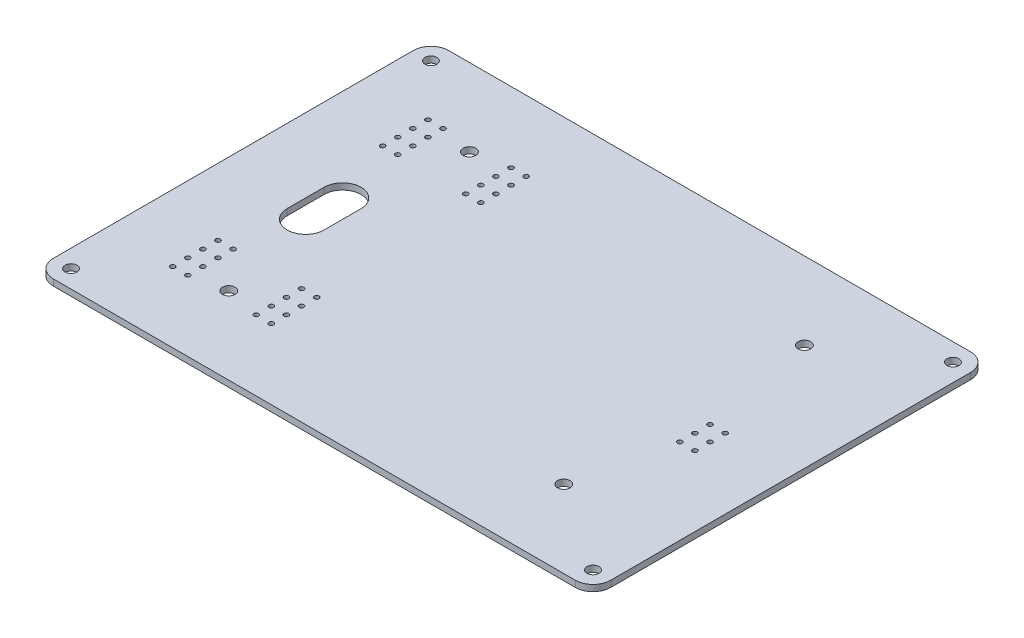
from build123d import *

# Parameters (mm, degrees)
BOSS_EXTRUDE1_DEPTH = 1.5875
SKETCH2_R           = 1.5875
CUT_EXTRUDE1_DEPTH  = 87.546171446
CUT_EXTRUDE2_DEPTH  = 87.546171446
SKETCH7_R           = 0.6
CUT_EXTRUDE3_DEPTH  = 87.546171446
SKETCH9_R           = 1.5
CUT_EXTRUDE4_DEPTH  = 87.546171446


with BuildPart() as part:
    # Sketch1 → Boss-Extrude1 (new body)
    with BuildSketch(Plane(origin=(0, 0, 0), x_dir=(1, 0, 0), z_dir=(0, 1, 0))):
        with BuildLine():
            Line((-65.410639449, -49.868760551), (66.237560551, -49.868760551))
            ThreePointArc((66.237560551, -49.868760551), (69.404663929, -48.556903378), (70.716521102, -45.3898))
            Line((70.716521102, -45.3898), (70.716521102, 45.3898))
            ThreePointArc((70.716521102, 45.3898), (69.404663929, 48.556903378), (66.237560551, 49.868760551))
            Line((66.237560551, 49.868760551), (-65.410639449, 49.868760551))
            ThreePointArc((-65.410639449, 49.868760551), (-68.577742827, 48.556903378), (-69.8896, 45.3898))
            Line((-69.8896, 45.3898), (-69.8896, -45.3898))
            ThreePointArc((-69.8896, -45.3898), (-68.577742827, -48.556903378), (-65.410639449, -49.868760551))
        make_face()
    extrude(amount=-BOSS_EXTRUDE1_DEPTH)

    # Sketch2 → Cut-Extrude1 (cut, through all)
    with BuildSketch(Plane(origin=(0, 0, 0), x_dir=(1, 0, 0), z_dir=(0, 1, 0))):
        with Locations((-40.6725, -30.35)):
            Circle(SKETCH2_R)
        with Locations((-40.6725, 30.35)):
            Circle(SKETCH2_R)
        with Locations((43.8275, 30.35)):
            Circle(SKETCH2_R)
        with Locations((43.8275, -30.35)):
            Circle(SKETCH2_R)
    extrude(amount=-CUT_EXTRUDE1_DEPTH, mode=Mode.SUBTRACT)

    # Sketch3 → Cut-Extrude2 (cut, through all)
    with BuildSketch(Plane(origin=(0, 0, 0), x_dir=(1, 0, 0), z_dir=(0, 1, 0))):
        with BuildLine():
            Line((-41.933471413, 4.284952831), (-41.933471413, -5.034952831))
            ThreePointArc((-41.933471413, -5.034952831), (-46.603471413, -9.704952831), (-51.273471413, -5.034952831))
            Line((-51.273471413, -5.034952831), (-51.273471413, 4.284952831))
            ThreePointArc((-51.273471413, 4.284952831), (-46.603471413, 8.954952831), (-41.933471413, 4.284952831))
        make_face()
    extrude(amount=-CUT_EXTRUDE2_DEPTH, mode=Mode.SUBTRACT)

    # Sketch7 → Cut-Extrude3 (cut, through all)
    with BuildSketch(Plane.XZ.offset(1.5875)):
        with Locations((49.2175, 6.483)):
            Circle(SKETCH7_R)
        with Locations((-49.1085, -32.125)):
            Circle(SKETCH7_R)
        with Locations((-28.1535, -32.125)):
            Circle(SKETCH7_R)
        with Locations((-28.1535, 20.707)):
            Circle(SKETCH7_R)
        with Locations((-49.2355, 20.707)):
            Circle(SKETCH7_R)
        with Locations((-31.9635, 20.707)):
            Circle(SKETCH7_R)
        with Locations((-53.0455, 20.707)):
            Circle(SKETCH7_R)
        with Locations((-31.9635, 28.327)):
            Circle(SKETCH7_R)
        with Locations((-53.0455, 28.327)):
            Circle(SKETCH7_R)
        with Locations((-31.9635, 24.517)):
            Circle(SKETCH7_R)
        with Locations((-53.0455, 24.517)):
            Circle(SKETCH7_R)
        with Locations((-31.9635, -28.315)):
            Circle(SKETCH7_R)
        with Locations((-52.9185, -28.315)):
            Circle(SKETCH7_R)
        with Locations((-31.9635, -32.125)):
            Circle(SKETCH7_R)
        with Locations((-52.9185, -32.125)):
            Circle(SKETCH7_R)
        with Locations((-28.1535, 24.517)):
            Circle(SKETCH7_R)
        with Locations((-49.2355, 24.517)):
            Circle(SKETCH7_R)
        with Locations((-31.9635, 32.137)):
            Circle(SKETCH7_R)
        with Locations((-53.0455, 32.137)):
            Circle(SKETCH7_R)
        with Locations((-31.9635, -20.695)):
            Circle(SKETCH7_R)
        with Locations((-52.9185, -20.695)):
            Circle(SKETCH7_R)
        with Locations((-31.9635, -24.505)):
            Circle(SKETCH7_R)
        with Locations((-52.9185, -24.505)):
            Circle(SKETCH7_R)
        with Locations((-28.1535, 32.137)):
            Circle(SKETCH7_R)
        with Locations((-49.2355, 32.137)):
            Circle(SKETCH7_R)
        with Locations((-28.1535, 28.327)):
            Circle(SKETCH7_R)
        with Locations((-49.2355, 28.327)):
            Circle(SKETCH7_R)
        with Locations((-28.1535, -24.505)):
            Circle(SKETCH7_R)
        with Locations((-49.1085, -24.505)):
            Circle(SKETCH7_R)
        with Locations((-28.1535, -28.315)):
            Circle(SKETCH7_R)
        with Locations((-49.1085, -28.315)):
            Circle(SKETCH7_R)
        with Locations((49.2175, 2.673)):
            Circle(SKETCH7_R)
        with Locations((53.0275, -1.137)):
            Circle(SKETCH7_R)
        with Locations((53.0275, 2.673)):
            Circle(SKETCH7_R)
        with Locations((53.0275, 6.483)):
            Circle(SKETCH7_R)
        with Locations((-28.1535, -20.695)):
            Circle(SKETCH7_R)
        with Locations((-49.1085, -20.695)):
            Circle(SKETCH7_R)
        with Locations((49.2175, -1.137)):
            Circle(SKETCH7_R)
    extrude(amount=-CUT_EXTRUDE3_DEPTH, mode=Mode.SUBTRACT)

    # Sketch9 → Cut-Extrude4 (cut, through all)
    with BuildSketch(Plane(origin=(0, 0, 0), x_dir=(1, 0, 0), z_dir=(0, 1, 0))):
        with Locations((-65.410639449, 45.3898)):
            Circle(SKETCH9_R)
        with Locations((-65.410639449, -45.3898)):
            Circle(SKETCH9_R)
        with Locations((66.237560551, 45.3898)):
            Circle(SKETCH9_R)
        with Locations((66.237560551, -45.3898)):
            Circle(SKETCH9_R)
    extrude(amount=-CUT_EXTRUDE4_DEPTH, mode=Mode.SUBTRACT)


solid = part.part
